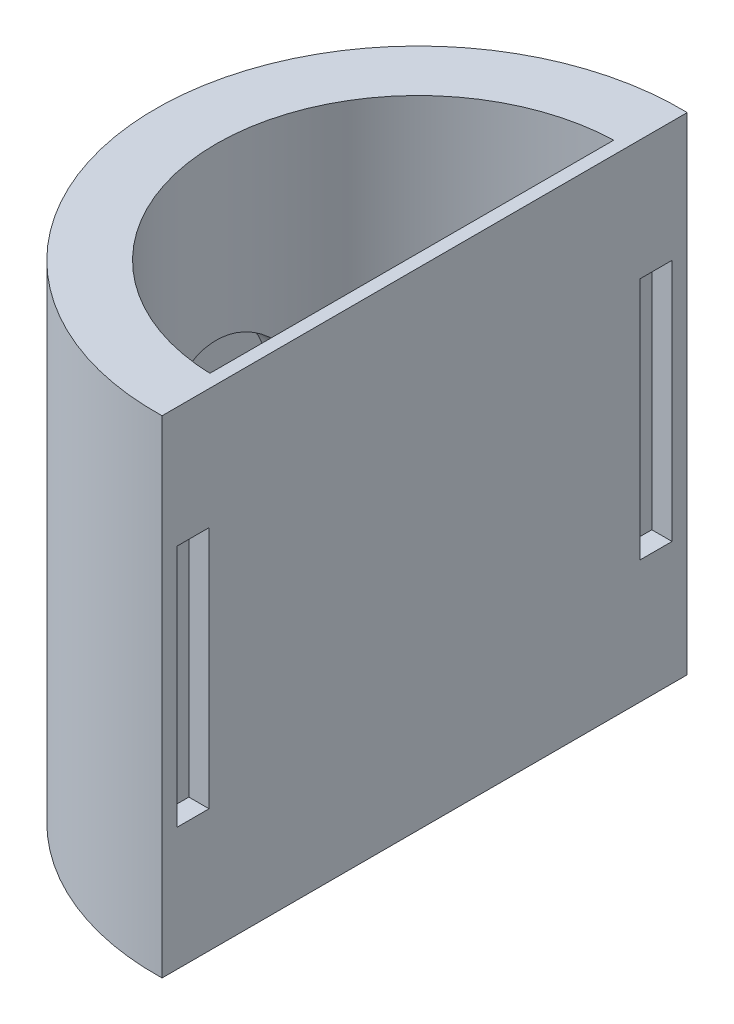
from build123d import *

# Parameters (mm, degrees)
SKETCH1_R                = 130
BOSS_EXTRUDE1_DEPTH      = 241.01
SKETCH2_R                = 100
CUT_EXTRUDE1_DEPTH       = 304.126739335
BOSS_EXTRUDE2_DEPTH      = 241.01
BODY_DELETE_KEEP_1_DEPTH = 241.01
SKETCH8_R                = 35
CUT_EXTRUDE2_DEPTH       = 10
CUT_EXTRUDE9_DEPTH       = 10
CUT_EXTRUDE9_DEPTH_BACK  = 10
SKETCH10_R               = 35
SKETCH16_W               = 15.74894652
SKETCH16_H               = 120.505
CUT_EXTRUDE10_DEPTH      = 10


# Read off the part's stored shape, not the designer's step: Body-Delete/Keep 1
with BuildPart() as part:
    # Sketch1 → Boss-Extrude1 (new body)
    with BuildSketch(Plane(origin=(0, 0, 0), x_dir=(1, 0, 0), z_dir=(0, 1, 0))):
        with Locations(Location((0, 0, 0), (0, 0, 270))):
            Circle(SKETCH1_R)
    extrude(amount=BOSS_EXTRUDE1_DEPTH)

    # Sketch2 → Cut-Extrude1 (cut, through all)
    with BuildSketch(Plane(origin=(0, 241.01, 0), x_dir=(1, 0, 0), z_dir=(0, 1, 0))):
        with Locations(Location((0, 0, 0), (0, 0, 270))):
            Circle(SKETCH2_R)
    extrude(amount=-CUT_EXTRUDE1_DEPTH, mode=Mode.SUBTRACT)


with BuildPart() as body_2:
    # Sketch5 → Boss-Extrude2 (new body)
    with BuildSketch(Plane(origin=(0, 0, 0), x_dir=(1, 0, 0), z_dir=(0, 1, 0))):
        Polygon((-3.175, -0.773064833), (-3.175, 104.496382322), (3.175, 104.496382322), (3.175, 0), (3.175, -106.678671161), (-3.175, -106.678671161), align=None)
    extrude(amount=BOSS_EXTRUDE2_DEPTH)


with BuildPart() as body_3:
    # Split1: the piece on the far side of the plane
    add(part.part)
    split(bisect_by=Plane(origin=(3.175, 0, 0), x_dir=(0, 0, 1), z_dir=(1, 0, 0)), keep=Keep.BOTTOM)

    # Combine2: union body 2
    add(body_2.part)

    # Sketch8 → Cut-Extrude2 (cut)
    with BuildSketch(Plane(origin=(-130, 0, 0), x_dir=(0, 0, -1), z_dir=(1, 0, 0))):
        with Locations(Location((0, 121.833368443, 0), (0, 0, 180))):
            Circle(SKETCH8_R)
    extrude(amount=CUT_EXTRUDE2_DEPTH, mode=Mode.SUBTRACT)

    # Sketch10 → Cut-Extrude9 (cut, two sides: drawn at the far end of the back side and taken through both)
    with BuildSketch(Plane(origin=(-100, 0, 0), x_dir=(0, 0, -1), z_dir=(1, 0, 0)).offset(-CUT_EXTRUDE9_DEPTH_BACK)):
        with Locations(Location((0, 121.833368443, 0), (0, 0, 180))):
            Circle(SKETCH10_R)
    extrude(amount=CUT_EXTRUDE9_DEPTH + CUT_EXTRUDE9_DEPTH_BACK, mode=Mode.SUBTRACT)

    # Sketch16 → Cut-Extrude10 (cut)
    with BuildSketch(Plane(origin=(3.175, 0, 0), x_dir=(0, 0, -1), z_dir=(1, 0, 0))):
        with Locations((-114.583839718, 121.169184221)):
            Rectangle(SKETCH16_W, SKETCH16_H)
    cut_extrude10 = extrude(amount=-CUT_EXTRUDE10_DEPTH, mode=Mode.SUBTRACT)

    # Mirror1: Cut-Extrude10 across plane
    add(cut_extrude10.mirror(Plane.XY), mode=Mode.SUBTRACT)


with BuildPart() as part_1:
    add(part.part)

    # Split1
    split(bisect_by=Plane(origin=(3.175, 0, 0), x_dir=(0, 0, 1), z_dir=(1, 0, 0)), keep=Keep.TOP)

    # Body-Delete/Keep 1 outline → Body-Delete/Keep 1 (cut)
    with BuildSketch(Plane(origin=(0, 0, 0), x_dir=(1, 0, 0), z_dir=(0, 1, 0))):
        with BuildLine():
            ThreePointArc((3.175, -129.961222582), (130, 0), (3.175, 129.961222582))
            Line((3.175, 129.961222582), (3.175, 99.949584166))
            ThreePointArc((3.175, 99.949584166), (100, 0), (3.175, -99.949584166))
            Line((3.175, -99.949584166), (3.175, -129.961222582))
        make_face()
    extrude(amount=BODY_DELETE_KEEP_1_DEPTH, mode=Mode.SUBTRACT)


solid = body_3.part
